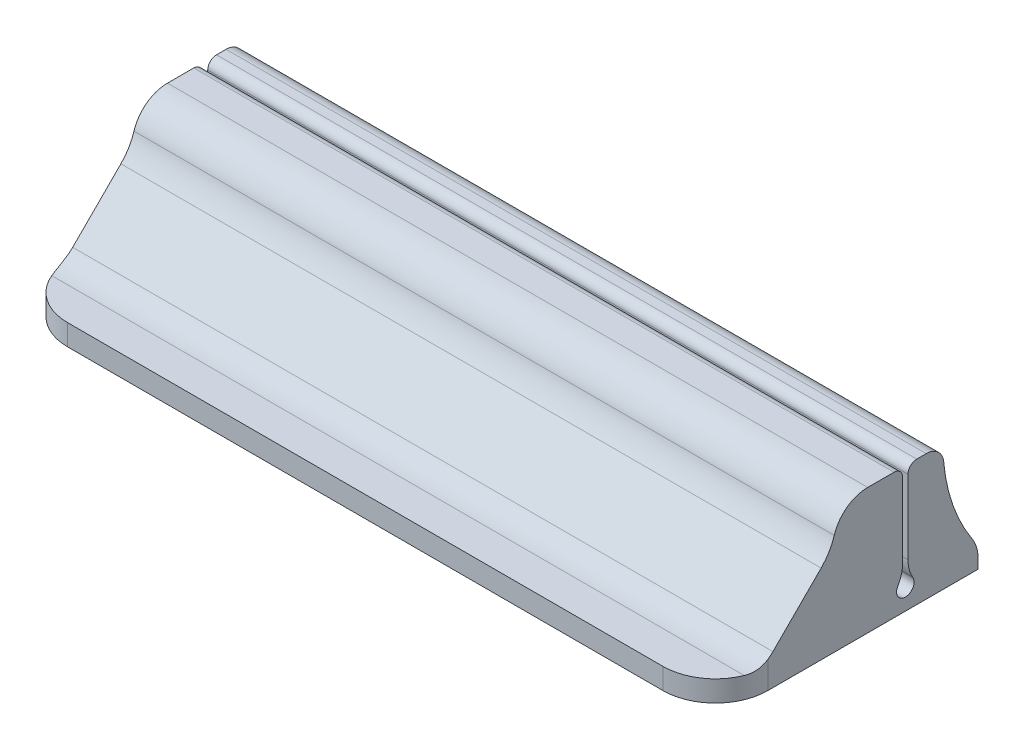
from build123d import *

# Parameters (mm, degrees)
SKETCH_1_W          = 40
SKETCH_1_H          = 15
EXTRUDE_1_DEPTH     = 1.2
SKETCH_2_W          = 40
SKETCH_2_H          = 2
SKETCH_2_H_2        = 4
EXTRUDE_2_DEPTH     = 6
FILLET_1_R          = 10
CHAMFER_1_SIZE      = 4
FILLET_2_R          = 2
FILLET_3_R          = 0.5
CUT_EXTRUDE_1_REACH = 43.329
SKETCH_3_R          = 0.5
FILLET_4_R          = 1
FILLET_5_R          = 2
FILLET_6_R          = 3
FILLET_7_R          = 2
FILLET_8_R          = 3


# Some blends are built 0.0001 mm under size
with BuildPart() as part:
    # 草图1 → 凸台-拉伸1 (new body)
    with BuildSketch(Plane(origin=(0, 0, 0), x_dir=(1, 0, 0), z_dir=(0, 1, 0))):
        Rectangle(SKETCH_1_W, SKETCH_1_H)
    extrude(amount=EXTRUDE_1_DEPTH)

    # 草图2 → 凸台-拉伸2 (add)
    with BuildSketch(Plane(origin=(0, 1.2, 0), x_dir=(1, 0, 0), z_dir=(0, 1, 0))):
        with Locations((0, 4.5)):
            Rectangle(SKETCH_2_W, SKETCH_2_H)
        with Locations((0, 1.2)):
            Rectangle(SKETCH_2_W, SKETCH_2_H_2)
    extrude(amount=EXTRUDE_2_DEPTH)

    # 圆角1
    # the kernel refuses this fillet: 10 mm, written as the material it adds along each edge
    with BuildSketch(Plane(origin=(-20, 1.2, -5.5), x_dir=(0, 0, -1), z_dir=(1, 0, 0))) as fillet_1_piece_1:
        with BuildLine():
            CenterArc((10, 6), FILLET_1_R, 180, 36.869897646)
            Line((0, 6), (-0.2, 6))
            Line((-0.2, 6), (-0.2, 0))
            Line((-0.2, 0), (0, -0.2))
            ThreePointArc((0, -0.2), (1, -0.2), (1.84, -0.12))
            Line((1.84, -0.12), (2, 0))
        make_face()
    extrude(amount=40)

    # 倒角1
    chamfer_1_edges = [part.edges().sort_by_distance(p)[0] for p in [
        (0, 1.2, 0.8),
    ]]
    chamfer(chamfer_1_edges, length=CHAMFER_1_SIZE)

    # 圆角2
    fillet_2_edges = [part.edges().sort_by_distance(p)[0] for p in [
        (0, 1.2, 4.8),
        (0, 7.2, 0.8),
    ]]
    fillet(fillet_2_edges, radius=FILLET_2_R - 0.0001)  # a hair under: the kernel refuses the full size

    # 圆角3
    fillet_3_edges = [part.edges().sort_by_distance(p)[0] for p in [
        (0, 7.2, -3.5),
        (0, 7.2, -3.2),
    ]]
    fillet(fillet_3_edges, radius=FILLET_3_R)

    # 草图3 → 切除-拉伸1 (cut, up to next)
    with BuildSketch(Plane(origin=(20, 0, 0), x_dir=(0, 0, -1), z_dir=(1, 0, 0)), mode=Mode.PRIVATE) as cut_extrude_1_sk1:
        with Locations((3.35, 1.2)):
            Circle(SKETCH_3_R)
    cut_extrude_1_tool1 = extrude(cut_extrude_1_sk1.sketch, amount=-CUT_EXTRUDE_1_REACH, mode=Mode.PRIVATE) & part.part
    add(cut_extrude_1_tool1.solids().sort_by_distance((20, 1.2, -3.35))[0], mode=Mode.SUBTRACT)

    # 圆角4
    fillet_4_edges = [part.edges().sort_by_distance(p)[0] for p in [
        (0, 7.2, -5.5),
    ]]
    fillet(fillet_4_edges, radius=FILLET_4_R)

    # 圆角5
    fillet_5_edges = [part.edges().sort_by_distance(p)[0] for p in [
        (0, 1.2, -7.5),
    ]]
    fillet(fillet_5_edges, radius=FILLET_5_R)

    # 圆角6
    fillet_6_edges = [part.edges().sort_by_distance(p)[0] for p in [
        (0, 5.2, 0.8),
    ]]
    fillet(fillet_6_edges, radius=FILLET_6_R)

    # 圆角7
    fillet_7_edges = [part.edges().sort_by_distance(p)[0] for p in [
        (0, 1.676969601, -3.5),
        (0, 1.676969601, -3.2),
    ]]
    fillet(fillet_7_edges, radius=FILLET_7_R)

    # 圆角8
    fillet_8_edges = [part.edges().sort_by_distance(p)[0] for p in [
        (20, 0.6, 7.5),
        (-20, 0.6, 7.5),
    ]]
    fillet(fillet_8_edges, radius=FILLET_8_R)


solid = part.part
